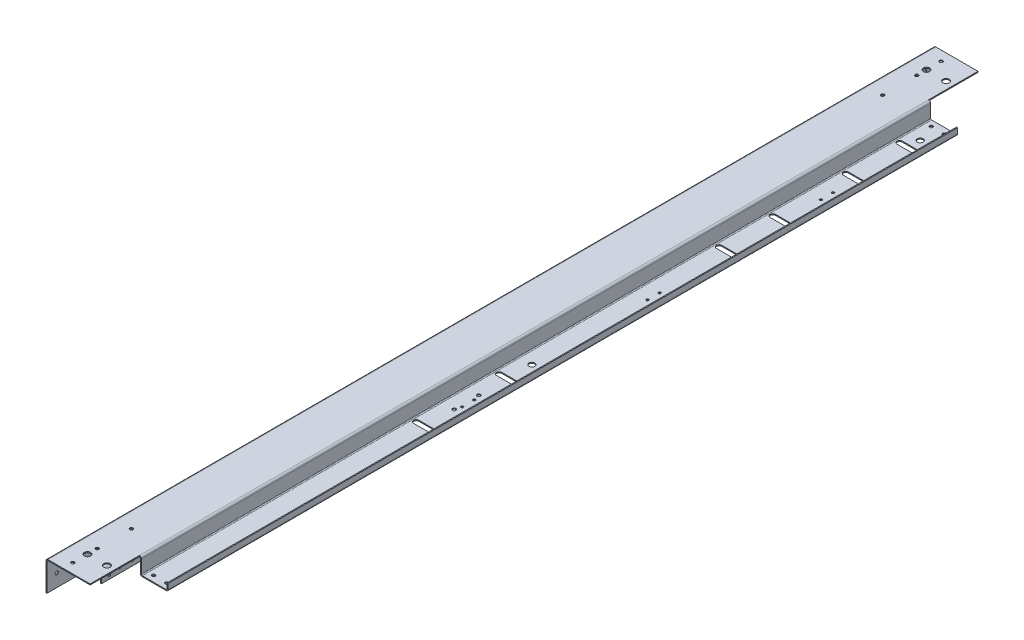
from build123d import *

# Parameters (mm, degrees)
SM_BASE_FLANGE_1_DEPTH = 910
SKETCH_6_W             = 17
SKETCH_6_H             = 97
CUT_EXTRUDE_1_DEPTH    = 24
SKETCH_7_W             = 101
SKETCH_7_H             = 35
CUT_EXTRUDE_2_DEPTH    = 59
CUT_EXTRUDE_3_DEPTH    = 10
SKETCH_9_R             = 3.5
SKETCH_9_R_2           = 6
CUT_EXTRUDE_3433_DEPTH = 10
SKETCH_10_R            = 3.25
SKETCH_10_R_2          = 6.5
CUT_EXTRUDE_5_DEPTH    = 10
SKETCH_11_R            = 2.5
CUT_EXTRUDE_6_DEPTH    = 10
SKETCH_12_R            = 3.25
CUT_EXTRUDE_7_DEPTH    = 10
SKETCH_13_R            = 2.5
CUT_EXTRUDE_8_DEPTH    = 10
SKETCH_16_R            = 2.5
CUT_EXTRUDE_11_DEPTH   = 10


# Sheet-metal steps are written as plain solids
with BuildPart() as part:
    # Sketch 1 → Базовая кромка1 (new, symmetric)
    with BuildSketch(Plane.XY):
        with BuildLine():
            Line((0, 0), (0, 18))
            ThreePointArc((0, 18), (-0.585786438, 19.414213562), (-2, 20))
            Line((-2, 20), (-11, 20))
            ThreePointArc((-11, 20), (-13.828427125, 21.171572875), (-15, 24))
            Line((-15, 24), (-15, 81))
            ThreePointArc((-15, 81), (-13.828427125, 83.828427125), (-11, 85))
            Line((-11, 85), (75.5, 85))
            ThreePointArc((75.5, 85), (78.328427125, 83.828427125), (79.5, 81))
            Line((79.5, 81), (79.5, 54))
            ThreePointArc((79.5, 54), (80.085786438, 52.585786438), (81.5, 52))
            Line((81.5, 52), (130.5, 52))
            ThreePointArc((130.5, 52), (131.914213562, 52.585786438), (132.5, 54))
            Line((132.5, 54), (132.5, 65))
            Line((132.5, 65), (134.5, 65))
            Line((134.5, 65), (134.5, 54))
            ThreePointArc((134.5, 54), (133.328427125, 51.171572875), (130.5, 50))
            Line((130.5, 50), (81.5, 50))
            ThreePointArc((81.5, 50), (78.671572875, 51.171572875), (77.5, 54))
            Line((77.5, 54), (77.5, 81))
            ThreePointArc((77.5, 81), (76.914213562, 82.414213562), (75.5, 83))
            Line((75.5, 83), (-11, 83))
            ThreePointArc((-11, 83), (-12.414213562, 82.414213562), (-13, 81))
            Line((-13, 81), (-13, 24))
            ThreePointArc((-13, 24), (-12.414213562, 22.585786438), (-11, 22))
            Line((-11, 22), (-2, 22))
            ThreePointArc((-2, 22), (0.828427125, 20.828427125), (2, 18))
            Line((2, 18), (2, 0))
            Line((2, 0), (0, 0))
        make_face()
    extrude(amount=SM_BASE_FLANGE_1_DEPTH, both=True)

    # Эскиз6 → Вырез-Вытянуть1 (cut)
    with BuildSketch(Plane.XZ):
        with Locations((-6.5, 861.5)):
            Rectangle(SKETCH_6_W, SKETCH_6_H)
        with Locations((-6.5, -861.5)):
            Rectangle(SKETCH_6_W, SKETCH_6_H)
    extrude(amount=-CUT_EXTRUDE_1_DEPTH, mode=Mode.SUBTRACT)

    # Эскиз7 → Вырез-Вытянуть2 (cut)
    with BuildSketch(Plane(origin=(134.5, 0, 0), x_dir=(0, 0, -1), z_dir=(1, 0, 0))):
        with Locations((859.5, 67.5)):
            Rectangle(SKETCH_7_W, SKETCH_7_H)
        with Locations((-859.5, 67.5)):
            Rectangle(SKETCH_7_W, SKETCH_7_H)
    extrude(amount=-CUT_EXTRUDE_2_DEPTH, mode=Mode.SUBTRACT)

    # Эскиз8 → Вырез-Вытянуть3 (cut)
    with BuildSketch(Plane.ZY.offset(15)):
        with BuildLine():
            Line((-5.5, 38), (-5.5, 67))
            ThreePointArc((-5.5, 67), (0, 72.5), (5.5, 67))
            Line((5.5, 67), (5.5, 38))
            ThreePointArc((5.5, 38), (0, 32.5), (-5.5, 38))
        make_face()
        with BuildLine():
            Line((-725.5, 38), (-725.5, 67))
            ThreePointArc((-725.5, 67), (-720, 72.5), (-714.5, 67))
            Line((-714.5, 67), (-714.5, 38))
            ThreePointArc((-714.5, 38), (-720, 32.5), (-725.5, 38))
        make_face()
        with BuildLine():
            Line((714.5, 38), (714.5, 67))
            ThreePointArc((714.5, 67), (720, 72.5), (725.5, 67))
            Line((725.5, 67), (725.5, 38))
            ThreePointArc((725.5, 38), (720, 32.5), (714.5, 38))
        make_face()
    extrude(amount=-CUT_EXTRUDE_3_DEPTH, mode=Mode.SUBTRACT)

    # Эскиз9 → Cut-Extrude 3433 (cut)
    with BuildSketch(Plane.XZ.offset(-50)):
        with Locations((106, 194)):
            Circle(SKETCH_9_R)
        with Locations((106, 144)):
            Circle(SKETCH_9_R)
        with Locations((106, 35)):
            Circle(SKETCH_9_R_2)
        with Locations((106, -761)):
            Circle(SKETCH_9_R_2)
        with BuildLine():
            Line((89, 90.5), (123, 90.5))
            ThreePointArc((123, 90.5), (128.5, 85), (123, 79.5))
            Line((123, 79.5), (89, 79.5))
            ThreePointArc((89, 79.5), (83.5, 85), (89, 90.5))
        make_face()
        with BuildLine():
            Line((89, 260.5), (123, 260.5))
            ThreePointArc((123, 260.5), (128.5, 255), (123, 249.5))
            Line((123, 249.5), (89, 249.5))
            ThreePointArc((89, 249.5), (83.5, 255), (89, 260.5))
        make_face()
        with BuildLine():
            Line((89, -360.5), (123, -360.5))
            ThreePointArc((123, -360.5), (128.5, -366), (123, -371.5))
            Line((123, -371.5), (89, -371.5))
            ThreePointArc((89, -371.5), (83.5, -366), (89, -360.5))
        make_face()
        with BuildLine():
            Line((89, -470.5), (123, -470.5))
            ThreePointArc((123, -470.5), (128.5, -476), (123, -481.5))
            Line((123, -481.5), (89, -481.5))
            ThreePointArc((89, -481.5), (83.5, -476), (89, -470.5))
        make_face()
        with BuildLine():
            Line((89, -620.5), (123, -620.5))
            ThreePointArc((123, -620.5), (128.5, -626), (123, -631.5))
            Line((123, -631.5), (89, -631.5))
            ThreePointArc((89, -631.5), (83.5, -626), (89, -620.5))
        make_face()
        with BuildLine():
            Line((89, -730.5), (123, -730.5))
            ThreePointArc((123, -730.5), (128.5, -736), (123, -741.5))
            Line((123, -741.5), (89, -741.5))
            ThreePointArc((89, -741.5), (83.5, -736), (89, -730.5))
        make_face()
    extrude(amount=-CUT_EXTRUDE_3433_DEPTH, mode=Mode.SUBTRACT)

    # Эскиз10 → Вырез-Вытянуть5 (cut)
    with BuildSketch(Plane(origin=(0, 85, 0), x_dir=(1, 0, 0), z_dir=(0, 1, 0))):
        with Locations(Location((20, 890, 0), (0, 0, 180))):
            Circle(SKETCH_10_R)
        with Locations(Location((20, 860, 0), (0, 0, 180))):
            Circle(SKETCH_10_R_2)
        with Locations(Location((20, 840, 0), (0, 0, 180))):
            Circle(SKETCH_10_R)
        with Locations(Location((60, 860, 0), (0, 0, 180))):
            Circle(SKETCH_10_R_2)
        with Locations(Location((20, 770, 0), (0, 0, 180))):
            Circle(SKETCH_10_R)
        with Locations((20, -770)):
            Circle(SKETCH_10_R)
        with Locations((60, -860)):
            Circle(SKETCH_10_R_2)
        with Locations((20, -840)):
            Circle(SKETCH_10_R)
        with Locations((20, -860)):
            Circle(SKETCH_10_R_2)
        with Locations((20, -890)):
            Circle(SKETCH_10_R)
    cut_extrude_5 = extrude(amount=-CUT_EXTRUDE_5_DEPTH, mode=Mode.SUBTRACT)

    # Зеркальное отражение1: Вырез-Вытянуть5 across plane
    add(cut_extrude_5.mirror(Plane(origin=(35, 35, 0), x_dir=(0, 0, 1), z_dir=(-0.7071067811865499, -0.7071067811865452, 0))), mode=Mode.SUBTRACT)

    # Эскиз11 → Вырез-Вытянуть6 (cut)
    with BuildSketch(Plane.ZY):
        with Locations((-797, 7)):
            Circle(SKETCH_11_R)
        with Locations((797, 7)):
            Circle(SKETCH_11_R)
    extrude(amount=-CUT_EXTRUDE_6_DEPTH, mode=Mode.SUBTRACT)

    # Эскиз12 → Вырез-Вытянуть7 (cut)
    with BuildSketch(Plane.XZ.offset(-50)):
        with Locations((92.5, 797)):
            Circle(SKETCH_12_R)
        with Locations((119.5, 797)):
            Circle(SKETCH_12_R)
        with Locations(Location((119.5, -797, 0), (0, 0, 180))):
            Circle(SKETCH_12_R)
        with Locations(Location((92.5, -797, 0), (0, 0, 180))):
            Circle(SKETCH_12_R)
    extrude(amount=-CUT_EXTRUDE_7_DEPTH, mode=Mode.SUBTRACT)

    # Эскиз13 → Вырез-Вытянуть8 (cut)
    with BuildSketch(Plane(origin=(2, 0, 0), x_dir=(0, 0, -1), z_dir=(1, 0, 0))):
        with Locations((775, 10)):
            Circle(SKETCH_13_R)
        with Locations((750, 10)):
            Circle(SKETCH_13_R)
        with Locations((725, 10)):
            Circle(SKETCH_13_R)
        with Locations((700, 10)):
            Circle(SKETCH_13_R)
        with Locations((650, 10)):
            Circle(SKETCH_13_R)
        with Locations((600, 10)):
            Circle(SKETCH_13_R)
        with Locations((550, 10)):
            Circle(SKETCH_13_R)
        with Locations((500, 10)):
            Circle(SKETCH_13_R)
        with Locations((450, 10)):
            Circle(SKETCH_13_R)
        with Locations((400, 10)):
            Circle(SKETCH_13_R)
        with Locations((350, 10)):
            Circle(SKETCH_13_R)
        with Locations((300, 10)):
            Circle(SKETCH_13_R)
        with Locations((250, 10)):
            Circle(SKETCH_13_R)
        with Locations((200, 10)):
            Circle(SKETCH_13_R)
        with Locations((150, 10)):
            Circle(SKETCH_13_R)
        with Locations((100, 10)):
            Circle(SKETCH_13_R)
        with Locations((50, 10)):
            Circle(SKETCH_13_R)
        with Locations((0, 10)):
            Circle(SKETCH_13_R)
        with Locations((-50, 10)):
            Circle(SKETCH_13_R)
        with Locations((-100, 10)):
            Circle(SKETCH_13_R)
        with Locations((-150, 10)):
            Circle(SKETCH_13_R)
        with Locations((-200, 10)):
            Circle(SKETCH_13_R)
        with Locations((-775, 10)):
            Circle(SKETCH_13_R)
        with Locations((-750, 10)):
            Circle(SKETCH_13_R)
        with Locations((-725, 10)):
            Circle(SKETCH_13_R)
        with Locations((-700, 10)):
            Circle(SKETCH_13_R)
        with Locations((-250, 10)):
            Circle(SKETCH_13_R)
        with Locations((-300, 10)):
            Circle(SKETCH_13_R)
        with Locations((-350, 10)):
            Circle(SKETCH_13_R)
        with Locations((-400, 10)):
            Circle(SKETCH_13_R)
        with Locations((-450, 10)):
            Circle(SKETCH_13_R)
    extrude(amount=-CUT_EXTRUDE_8_DEPTH, mode=Mode.SUBTRACT)

    # Эскиз16 → Вырез-Вытянуть11 (cut)
    with BuildSketch(Plane(origin=(0, 52, 0), x_dir=(1, 0, 0), z_dir=(0, 1, 0))):
        with Locations(Location((109.5, 579, 0), (0, 0, 180))):
            Circle(SKETCH_16_R)
        with Locations(Location((109.5, 554, 0), (0, 0, 180))):
            Circle(SKETCH_16_R)
        with Locations(Location((109.5, 223.5, 0), (0, 0, 180))):
            Circle(SKETCH_16_R)
        with Locations(Location((109.5, 198.5, 0), (0, 0, 180))):
            Circle(SKETCH_16_R)
        with Locations(Location((109.5, -156.5, 0), (0, 0, 180))):
            Circle(SKETCH_16_R)
        with Locations(Location((109.5, -181.5, 0), (0, 0, 180))):
            Circle(SKETCH_16_R)
    extrude(amount=-CUT_EXTRUDE_11_DEPTH, mode=Mode.SUBTRACT)


solid = part.part
